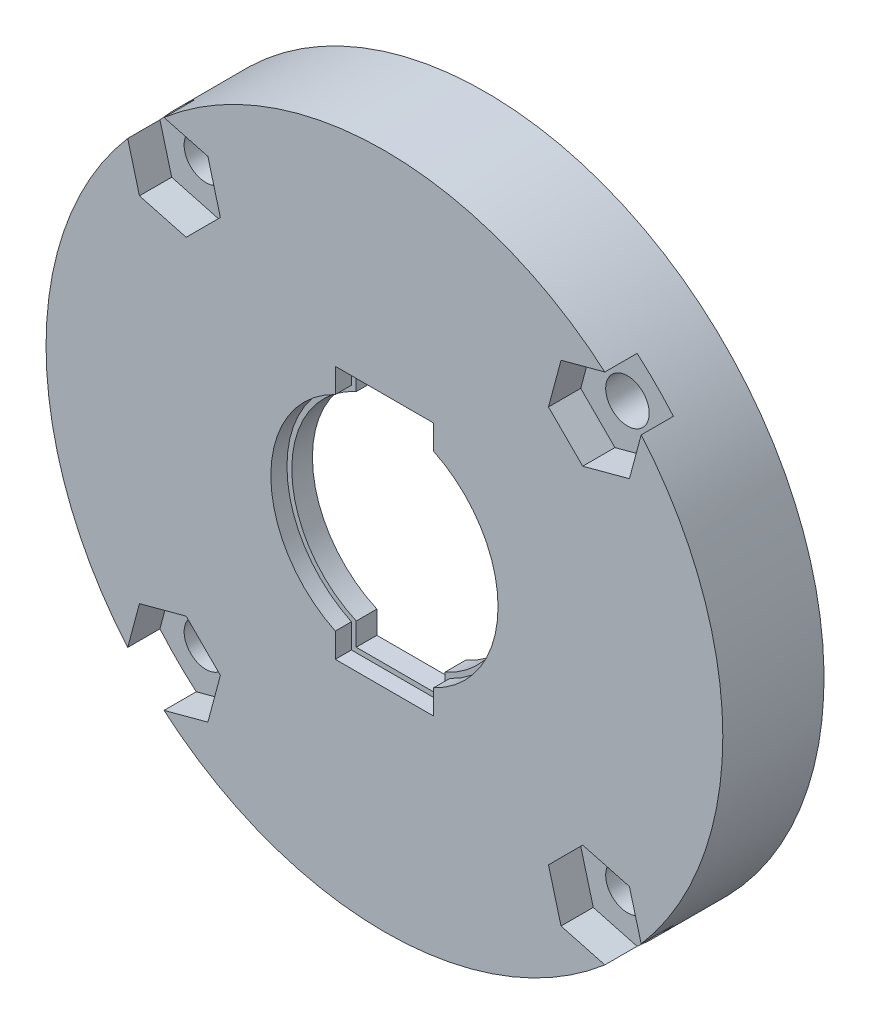
from build123d import *

# Parameters (mm, degrees)
SKETCH3_R           = 21
BOSS_EXTRUDE2_DEPTH = 1
SKETCH4_R           = 21
BOSS_EXTRUDE3_DEPTH = 5.28
SKETCH5_R           = 16.5
CUT_EXTRUDE1_DEPTH  = 4
CUT_EXTRUDE2_DEPTH  = 2
SKETCH8_R           = 1.35
CUT_EXTRUDE4_DEPTH  = 31.355203837
CIRPATTERN1_COUNT   = 4


with BuildPart() as part:
    # Sketch3 → Boss-Extrude2 (new body)
    with BuildSketch(Plane.XY):
        Circle(SKETCH3_R)
        with BuildLine():
            Line((3.050012, 6.356093675), (3.050012, 7.874431))
            Line((3.050012, 7.874431), (-3.049988, 7.874431))
            Line((-3.049988, 7.874431), (-3.049988, 6.356105191))
            ThreePointArc((-3.049988, 6.356105191), (-7.05, 0), (-3.049988, -6.356105191))
            Line((-3.049988, -6.356105191), (-3.049988, -7.874679))
            Line((-3.049988, -7.874679), (3.050012, -7.874679))
            Line((3.050012, -7.874679), (3.050012, -6.356093675))
            ThreePointArc((3.050012, -6.356093675), (7.05, 0), (3.050012, 6.356093675))
        make_face(mode=Mode.SUBTRACT)
    extrude(amount=-BOSS_EXTRUDE2_DEPTH)

    # Sketch4 → Boss-Extrude3 (add)
    with BuildSketch(Plane(origin=(0, 0, -1), x_dir=(-1, 0, 0), z_dir=(0, 0, -1))):
        Circle(SKETCH4_R)
        with BuildLine():
            Line((2.749988, 6.164419356), (2.749988, 7.574431))
            Line((2.749988, 7.574431), (-2.750012, 7.574431))
            Line((-2.750012, 7.574431), (-2.750012, 6.16440865))
            ThreePointArc((-2.750012, 6.16440865), (-6.75, 0), (-2.750012, -6.16440865))
            Line((-2.750012, -6.16440865), (-2.750012, -7.574679))
            Line((-2.750012, -7.574679), (2.749988, -7.574679))
            Line((2.749988, -7.574679), (2.749988, -6.164419356))
            ThreePointArc((2.749988, -6.164419356), (6.75, 0), (2.749988, 6.164419356))
        make_face(mode=Mode.SUBTRACT)
    extrude(amount=BOSS_EXTRUDE3_DEPTH)

    # Sketch5 → Cut-Extrude1 (cut)
    with BuildSketch(Plane(origin=(0, 0, -6.28), x_dir=(-1, 0, 0), z_dir=(0, 0, -1))):
        Circle(SKETCH5_R)
    extrude(amount=-CUT_EXTRUDE1_DEPTH, mode=Mode.SUBTRACT)

    # Sketch6 → Cut-Extrude2 (cut)
    with BuildSketch(Plane.XY):
        Polygon((13.858507528, 15.981398638), (10.958584342, 15.204366562), (10.181552266, 12.304443376), (12.304443376, 10.181552266), (15.204366562, 10.958584342), (15.981398638, 13.858507528), align=None)
    cut_extrude2 = extrude(amount=-CUT_EXTRUDE2_DEPTH, mode=Mode.SUBTRACT)

    # Sketch8 → Cut-Extrude4 (cut, through all)
    with BuildSketch(Plane.XY):
        with Locations((13.081475452, 13.081475452)):
            Circle(SKETCH8_R)
    cut_extrude4 = extrude(amount=-CUT_EXTRUDE4_DEPTH, mode=Mode.SUBTRACT)

    # CirPattern1: Cut-Extrude2, Cut-Extrude4 ×4 about axis
    cirpattern1_axis = Axis((0, 0, -0.1), (0, 0, 1))
    add([cut_extrude2.rotate(cirpattern1_axis, i * 360 / CIRPATTERN1_COUNT) for i in range(1, CIRPATTERN1_COUNT)], mode=Mode.SUBTRACT)
    add([cut_extrude4.rotate(cirpattern1_axis, i * 360 / CIRPATTERN1_COUNT) for i in range(1, CIRPATTERN1_COUNT)], mode=Mode.SUBTRACT)


solid = part.part
